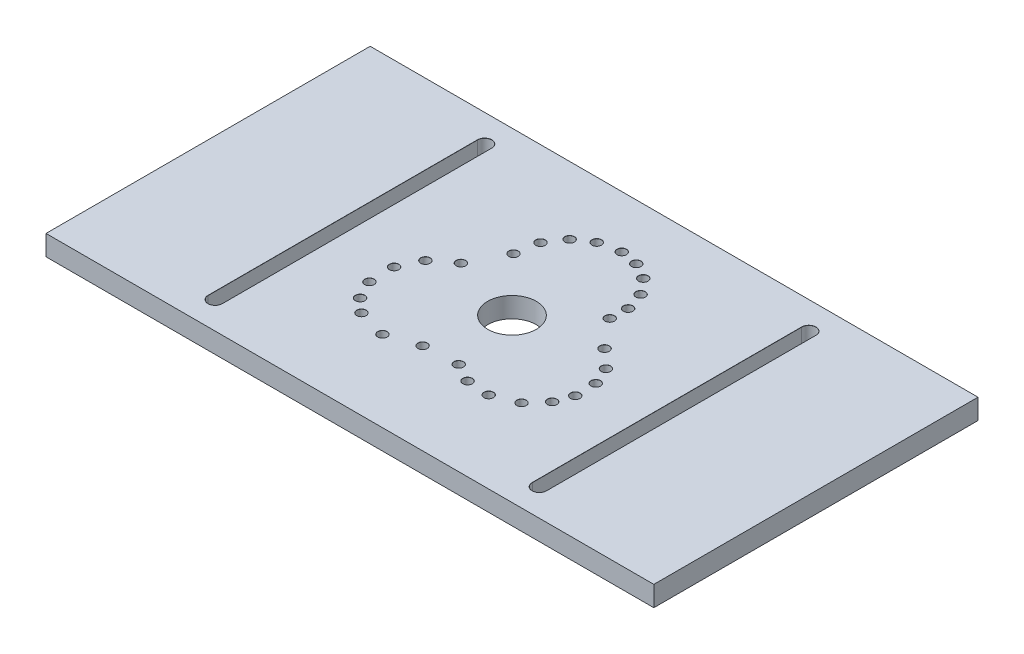
from build123d import *

# Parameters (mm, degrees)
SKETCH1_W                            = 150
SKETCH1_H                            = 80
BOSS_EXTRUDE1_DEPTH                  = 5
SKETCH2_R                            = 6
CUT_EXTRUDE1_DEPTH                   = 5
F_2_3_2_3_DIAMETER_HOLE1_D           = 2.3
F_2_3_2_3_DIAMETER_HOLE1_CSINK_D     = 2.35
F_2_3_2_3_DIAMETER_HOLE1_CSINK_ANGLE = 90
F_3_5_START                          = -1
F_3_5_3_5_DIAMETER_SLOT1_DEPTH       = 7


with BuildPart() as part:
    # Sketch1 → Boss-Extrude1 (new body)
    with BuildSketch(Plane(origin=(0, 0, 0), x_dir=(1, 0, 0), z_dir=(0, 1, 0))):
        Rectangle(SKETCH1_W, SKETCH1_H)
    extrude(amount=BOSS_EXTRUDE1_DEPTH)

    # Sketch2 → Cut-Extrude1 (cut)
    with BuildSketch(Plane(origin=(0, 5, 0), x_dir=(1, 0, 0), z_dir=(0, 1, 0))):
        with Locations(Location((0, 0, 0), (0, 0, 270))):
            Circle(SKETCH2_R)
    extrude(amount=-CUT_EXTRUDE1_DEPTH, mode=Mode.SUBTRACT)

    # Ø2.3 (2.3) Diameter Hole1 (through all)
    with Locations(Plane(origin=(0, 5, 0), x_dir=(1, 0, 0), z_dir=(0, 1, 0))):
        with Locations((18.525219477, 4.313899021), (-12.013304258, 19.048075911), (-12.979283121, 13.346498811), (-9.119541427, 23.344788673), (-5.121281637, 26.028870187), (0, 27.080126555), (4.322325112, 26.34053053), (8.317289006, 24.071257802), (11.39218392, 20.342565819), (12.889434778, 15.772010445), (12.719856903, 11.395868677), (-22.39534299, 1.017693549), (-24.881267093, -4.206895241), (-24.740263888, -10.443726178), (-22.437378406, -15.04431349), (-19.095176636, -18.056881008), (-17.46243869, 4.844417817), (-4.532909997, -17.54299487), (-11.928504706, -20.037357087), (3.910972218, -17.05982561), (8.568273344, -19.524290875), (14.139900873, -19.89356421), (19.874082729, -17.528745152), (23.452077534, -13.540063277), (24.981853962, -9.377653409), (24.881267093, -4.206895241), (23.006620796, 0.176706529)):
            CounterSinkHole(F_2_3_2_3_DIAMETER_HOLE1_D / 2, F_2_3_2_3_DIAMETER_HOLE1_CSINK_D / 2, counter_sink_angle=F_2_3_2_3_DIAMETER_HOLE1_CSINK_ANGLE)

    # Ø3.5 (3.5) Diameter Slot1: read off the stored shape, not the designer's step
    # Ø3.5 (3.5) Diameter Slot1 outline → Ø3.5 (3.5) Diameter Slot1 (cut)
    with BuildSketch(Plane(origin=(0, 0, 0), x_dir=(1, 0, 0), z_dir=(0, 1, 0)).offset(F_3_5_START)):
        with BuildLine():
            Line((41.75, -33.25), (41.75, 33.25))
            ThreePointArc((41.75, 33.25), (40, 35), (38.25, 33.25))
            Line((38.25, 33.25), (38.25, -33.25))
            ThreePointArc((38.25, -33.25), (40, -35), (41.75, -33.25))
        make_face()
        with BuildLine():
            Line((-38.25, -33.25), (-38.25, 33.25))
            ThreePointArc((-38.25, 33.25), (-40, 35), (-41.75, 33.25))
            Line((-41.75, 33.25), (-41.75, -33.25))
            ThreePointArc((-41.75, -33.25), (-40, -35), (-38.25, -33.25))
        make_face()
    extrude(amount=F_3_5_3_5_DIAMETER_SLOT1_DEPTH, mode=Mode.SUBTRACT)

    # 3.5 _3.5_ Diameter Slot1 2: loft between two sections, ruled curve by curve
    f_3_5_3_5_diameter_slot1_2_from = [
        Edge.make_three_point_arc((41.75, 4.975, -33.25), (41.237436867, 4.975, -34.487436867), (40, 4.975, -35)),
        Edge.make_three_point_arc((40, 4.975, -35), (38.762563133, 4.975, -34.487436867), (38.25, 4.975, -33.25)),
        Edge.make_three_point_arc((38.25, 4.975, 33.25), (38.762563133, 4.975, 34.487436867), (40, 4.975, 35)),
        Edge.make_three_point_arc((40, 4.975, 35), (41.237436867, 4.975, 34.487436867), (41.75, 4.975, 33.25)),
        Edge.make_line((38.25, 4.975, -33.25), (38.25, 4.975, 33.25)),
        Edge.make_line((41.75, 4.975, -33.25), (41.75, 4.975, 33.25)),
    ]
    f_3_5_3_5_diameter_slot1_2_to = [
        Edge.make_three_point_arc((41.775, 5, -33.25), (41.255114537, 5, -34.505114537), (40, 5, -35.025)),
        Edge.make_three_point_arc((40, 5, -35.025), (38.744885463, 5, -34.505114537), (38.225, 5, -33.25)),
        Edge.make_three_point_arc((38.225, 5, 33.25), (38.744885463, 5, 34.505114537), (40, 5, 35.025)),
        Edge.make_three_point_arc((40, 5, 35.025), (41.255114537, 5, 34.505114537), (41.775, 5, 33.25)),
        Edge.make_line((38.225, 5, -33.25), (38.225, 5, 33.25)),
        Edge.make_line((41.775, 5, -33.25), (41.775, 5, 33.25)),
    ]
    f_3_5_3_5_diameter_slot1_2 = Solid(Shell([*[Face.make_surface_from_curves(f_3_5_3_5_diameter_slot1_2_from[k], f_3_5_3_5_diameter_slot1_2_to[k]) for k in range(6)], Face(Wire(f_3_5_3_5_diameter_slot1_2_from)), Face(Wire(f_3_5_3_5_diameter_slot1_2_to))]))
    add(f_3_5_3_5_diameter_slot1_2, mode=Mode.SUBTRACT)

    # 3.5 _3.5_ Diameter Slot1 3: loft between two sections, ruled curve by curve
    f_3_5_3_5_diameter_slot1_3_from = [
        Edge.make_three_point_arc((-38.25, 4.975, -33.25), (-38.762563133, 4.975, -34.487436867), (-40, 4.975, -35)),
        Edge.make_three_point_arc((-40, 4.975, -35), (-41.237436867, 4.975, -34.487436867), (-41.75, 4.975, -33.25)),
        Edge.make_three_point_arc((-41.75, 4.975, 33.25), (-41.237436867, 4.975, 34.487436867), (-40, 4.975, 35)),
        Edge.make_three_point_arc((-40, 4.975, 35), (-38.762563133, 4.975, 34.487436867), (-38.25, 4.975, 33.25)),
        Edge.make_line((-41.75, 4.975, -33.25), (-41.75, 4.975, 33.25)),
        Edge.make_line((-38.25, 4.975, -33.25), (-38.25, 4.975, 33.25)),
    ]
    f_3_5_3_5_diameter_slot1_3_to = [
        Edge.make_three_point_arc((-38.225, 5, -33.25), (-38.744885463, 5, -34.505114537), (-40, 5, -35.025)),
        Edge.make_three_point_arc((-40, 5, -35.025), (-41.255114537, 5, -34.505114537), (-41.775, 5, -33.25)),
        Edge.make_three_point_arc((-41.775, 5, 33.25), (-41.255114537, 5, 34.505114537), (-40, 5, 35.025)),
        Edge.make_three_point_arc((-40, 5, 35.025), (-38.744885463, 5, 34.505114537), (-38.225, 5, 33.25)),
        Edge.make_line((-41.775, 5, -33.25), (-41.775, 5, 33.25)),
        Edge.make_line((-38.225, 5, -33.25), (-38.225, 5, 33.25)),
    ]
    f_3_5_3_5_diameter_slot1_3 = Solid(Shell([*[Face.make_surface_from_curves(f_3_5_3_5_diameter_slot1_3_from[k], f_3_5_3_5_diameter_slot1_3_to[k]) for k in range(6)], Face(Wire(f_3_5_3_5_diameter_slot1_3_from)), Face(Wire(f_3_5_3_5_diameter_slot1_3_to))]))
    add(f_3_5_3_5_diameter_slot1_3, mode=Mode.SUBTRACT)


solid = part.part
